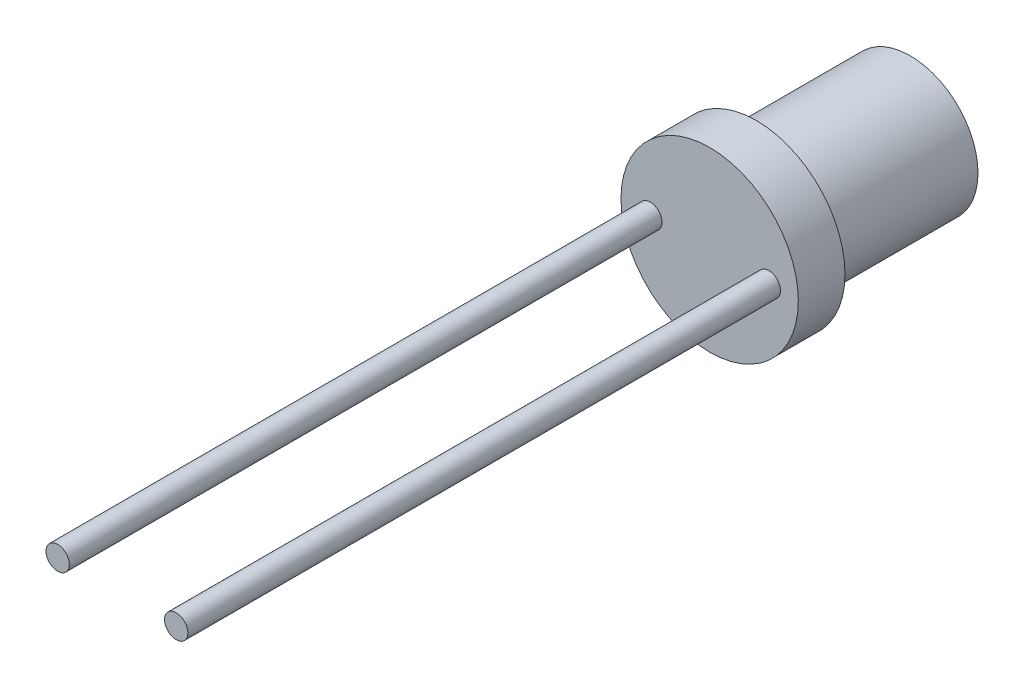
from build123d import *

# Parameters (mm, degrees)
SKETCH_1_R      = 1.45
EXTRUDE_1_DEPTH = 3.3
SKETCH_2_R      = 1.9
EXTRUDE_2_DEPTH = 1
SKETCH_3_R      = 0.25
EXTRUDE_3_DEPTH = 12.7


with BuildPart() as part:
    # 草图1 → 拉伸1 (new body)
    with BuildSketch(Plane.XY):
        Circle(SKETCH_1_R)
    extrude(amount=EXTRUDE_1_DEPTH)

    # 草图2 → 拉伸2 (add)
    with BuildSketch(Plane.XY.offset(3.3)):
        Circle(SKETCH_2_R)
    extrude(amount=EXTRUDE_2_DEPTH)

    # 草图3 → 拉伸3 (add)
    with BuildSketch(Plane.XY.offset(4.3)):
        with Locations((-1.27, 0)):
            Circle(SKETCH_3_R)
        with Locations((1.27, 0)):
            Circle(SKETCH_3_R)
    extrude(amount=EXTRUDE_3_DEPTH)


solid = part.part
